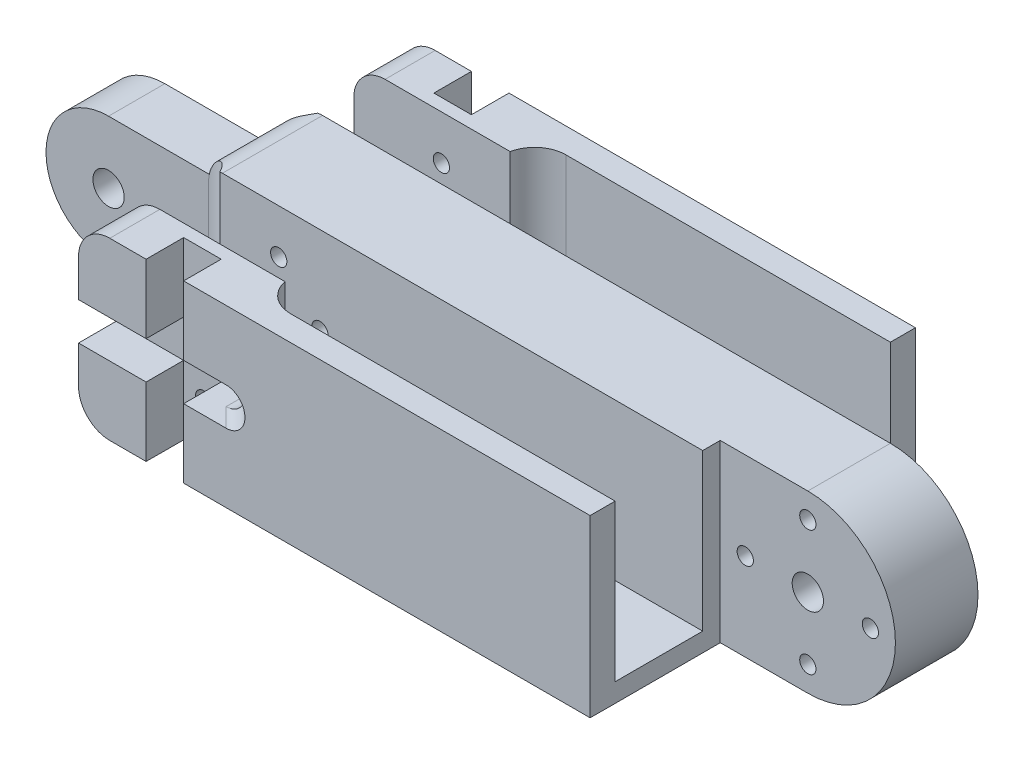
from build123d import *

# Parameters (mm, degrees)
SKETCH1_W                        = 81.77
SKETCH1_H                        = 28
BOSS_EXTRUDE1_DEPTH              = 4
BOSS_EXTRUDE2_DEPTH              = 4
SKETCH3_W                        = 81.77
SKETCH3_H                        = 3
BOSS_EXTRUDE3_DEPTH              = 10
BOSS_EXTRUDE4_DEPTH              = 4.2
BOSS_EXTRUDE5_DEPTH              = 9
SKETCH6_W                        = 81.77
SKETCH6_H                        = 28
BOSS_EXTRUDE6_DEPTH              = 2.8
SKETCH7_W                        = 81.77
SKETCH7_H                        = 3
BOSS_EXTRUDE7_DEPTH              = 10
BOSS_EXTRUDE8_DEPTH              = 4
SKETCH9_W                        = 81.77
SKETCH9_H                        = 28
BOSS_EXTRUDE9_DEPTH              = 4
FILLET1_R                        = 5
SKETCH10_R                       = 5
CUT_EXTRUDE2_DEPTH               = 25
CUT_EXTRUDE3_DEPTH               = 6
CUT_EXTRUDE4_START               = -6
CUT_EXTRUDE4_DEPTH               = 6
CUT_EXTRUDE5_REACH               = 119.503
SKETCH13_R                       = 2.5
CUT_EXTRUDE6_REACH               = 119.503
SKETCH14_R                       = 2.5
M3X0_5_TAPPED_HOLE1_D            = 2.6
M3X0_5_TAPPED_HOLE1_DEPTH        = 9
M3X0_5_TAPPED_HOLE1_TIP          = 0.781118805
TAP_DRILL_FOR_M3X0_5_TAP1_D      = 2.6
TAP_DRILL_FOR_M3X0_5_TAP2_REACH  = 141.209
TAP_DRILL_FOR_M3X0_5_TAP2_BORE_R = 1.3
CUT_EXTRUDE8_START               = 10.323759005
CUT_EXTRUDE8_DEPTH               = 9.676240995
BOSS_EXTRUDE10_DEPTH             = 0.01
BOSS_EXTRUDE10_DEPTH_BACK        = 0.01


with BuildPart() as part:
    # Sketch1 → Boss-Extrude1 (new body)
    with BuildSketch(Plane.XY):
        with Locations((40.885, 14)):
            Rectangle(SKETCH1_W, SKETCH1_H)
    extrude(amount=BOSS_EXTRUDE1_DEPTH)

    # Sketch2 → Boss-Extrude2 (add)
    with BuildSketch(Plane.XY.offset(4)):
        Polygon((0, 0), (25, 0), (81.77, 0), (81.77, 3), (25, 2.882144556), (25, 28), (0, 28), align=None)
    extrude(amount=BOSS_EXTRUDE2_DEPTH)

    # Sketch3 → Boss-Extrude3 (add)
    with BuildSketch(Plane.XY.offset(8)):
        with Locations((40.885, 1.5)):
            Rectangle(SKETCH3_W, SKETCH3_H)
    extrude(amount=BOSS_EXTRUDE3_DEPTH)

    # Sketch4 → Boss-Extrude4 (add)
    with BuildSketch(Plane.XY.offset(18)):
        with BuildLine():
            Line((0, 0), (95.77, 0))
            ThreePointArc((95.77, 0), (109.77, 14), (95.77, 28))
            Line((95.77, 28), (0, 28))
            Line((0, 28), (0, 0))
        make_face()
    extrude(amount=BOSS_EXTRUDE4_DEPTH)

    # Sketch5 → Boss-Extrude5 (add)
    with BuildSketch(Plane.XY.offset(22.2)):
        with BuildLine():
            Line((0, 24), (0, 28))
            Line((0, 28), (95.77, 28))
            ThreePointArc((95.77, 28), (109.77, 14), (95.77, 0))
            Line((95.77, 0), (0, 0))
            Line((0, 0), (0, 4))
            Line((0, 4), (-16, 4))
            ThreePointArc((-16, 4), (-26, 14), (-16, 24))
            Line((-16, 24), (0, 24))
        make_face()
    extrude(amount=BOSS_EXTRUDE5_DEPTH)

    # Sketch6 → Boss-Extrude6 (add)
    with BuildSketch(Plane.XY.offset(31.2)):
        with Locations((40.885, 14)):
            Rectangle(SKETCH6_W, SKETCH6_H)
    extrude(amount=BOSS_EXTRUDE6_DEPTH)

    # Sketch7 → Boss-Extrude7 (add)
    with BuildSketch(Plane.XY.offset(34)):
        with Locations((40.885, 1.5)):
            Rectangle(SKETCH7_W, SKETCH7_H)
    extrude(amount=BOSS_EXTRUDE7_DEPTH)

    # Sketch8 → Boss-Extrude8 (add)
    with BuildSketch(Plane.XY.offset(44)):
        Polygon((0, 0), (25, 0), (81.77, 0), (81.77, 3), (25, 3), (25, 28), (0, 28), align=None)
    extrude(amount=BOSS_EXTRUDE8_DEPTH)

    # Sketch9 → Boss-Extrude9 (add)
    with BuildSketch(Plane.XY.offset(48)):
        with Locations((40.885, 14)):
            Rectangle(SKETCH9_W, SKETCH9_H)
    extrude(amount=BOSS_EXTRUDE9_DEPTH)

    # Fillet1
    # the kernel refuses this fillet: 5 mm, written as the material it adds along each edge
    with BuildSketch(Plane(origin=(25, 3, 48), x_dir=(1.5729639812884161e-12, 0, -1.0), z_dir=(0, 1, 0))) as fillet1_piece_1:
        with BuildLine():
            CenterArc((5, -4.898979486), FILLET1_R, 101.536959033, 78.463040967)
            Line((0, -4.898979486), (0, 0))
            Line((0, 0), (4, 0))
        make_face()
    extrude(amount=25)
    with BuildSketch(Plane(origin=(25, -9.365304158, 4), x_dir=(1.5756285165475155e-12, 0, 1.0), z_dir=(0, 1, 0))) as fillet1_piece_2_section:
        with BuildLine():
            CenterArc((5, 4.898979486), FILLET1_R, 180, 78.463040967)
            Line((0, 4.898979486), (0, 0))
            Line((0, 0), (4, 0))
        make_face()
    fillet1_piece_2 = extrude(amount=37.365304158, mode=Mode.PRIVATE)
    fillet1_piece_2 = split(fillet1_piece_2, bisect_by=Plane(origin=(24.974574207, 2.882091771, 4), z_dir=(-0.0020760118056059734, 0.9999978450851698, 0)), keep=Keep.TOP, mode=Mode.PRIVATE)
    add(fillet1_piece_2)
    # the kernel refuses this fillet: 5 mm, written as the material it takes off along each edge
    with BuildSketch(Plane(origin=(0, 28, 46.5), x_dir=(0, -1, 0), z_dir=(0, 0, -1))) as fillet1_2_piece_1_section:
        with BuildLine():
            CenterArc((FILLET1_R, -FILLET1_R), FILLET1_R, 90, 90)
            Line((0, -FILLET1_R), (0, 0))
            Line((0, 0), (FILLET1_R, 0))
        make_face()
    fillet1_2_piece_1 = extrude(amount=41, mode=Mode.PRIVATE)
    fillet1_2_piece_1 = split(fillet1_2_piece_1, bisect_by=Plane(origin=(0, 28, 31.2), z_dir=(0, 0, 1)), keep=Keep.TOP, mode=Mode.PRIVATE)
    add(fillet1_2_piece_1, mode=Mode.SUBTRACT)
    with BuildSketch(Plane(origin=(0, 28, 46.5), x_dir=(0, -1, 0), z_dir=(0, 0, -1))) as fillet1_2_piece_2_section:
        with BuildLine():
            CenterArc((FILLET1_R, -FILLET1_R), FILLET1_R, 90, 90)
            Line((0, -FILLET1_R), (0, 0))
            Line((0, 0), (FILLET1_R, 0))
        make_face()
    fillet1_2_piece_2 = extrude(amount=41, mode=Mode.PRIVATE)
    fillet1_2_piece_2 = split(fillet1_2_piece_2, bisect_by=Plane(origin=(0, 24, 46.5), z_dir=(0, 1, 0)), keep=Keep.TOP, mode=Mode.PRIVATE)
    add(fillet1_2_piece_2, mode=Mode.SUBTRACT)
    with BuildSketch(Plane(origin=(0, 28, 46.5), x_dir=(0, -1, 0), z_dir=(0, 0, -1))) as fillet1_2_piece_3_section:
        with BuildLine():
            CenterArc((FILLET1_R, -FILLET1_R), FILLET1_R, 90, 90)
            Line((0, -FILLET1_R), (0, 0))
            Line((0, 0), (FILLET1_R, 0))
        make_face()
    fillet1_2_piece_3 = extrude(amount=41, mode=Mode.PRIVATE)
    fillet1_2_piece_3 = split(fillet1_2_piece_3, bisect_by=Plane(origin=(0, 28, 22.2), z_dir=(0, 0, -1)), keep=Keep.TOP, mode=Mode.PRIVATE)
    add(fillet1_2_piece_3, mode=Mode.SUBTRACT)
    with BuildSketch(Plane(origin=(0, 28, 64.5), x_dir=(0, -1, 0), z_dir=(0, 0, -1)), Plane(origin=(0, 28, 20.5), x_dir=(0, -1, 0), z_dir=(0, 0, -1))) as fillet1_2_piece_4:
        with BuildLine():
            CenterArc((FILLET1_R, -FILLET1_R), FILLET1_R, 90, 90)
            Line((0, -FILLET1_R), (0, 0))
            Line((0, 0), (FILLET1_R, 0))
        make_face()
    extrude(amount=33, mode=Mode.SUBTRACT)
    with BuildSketch(Plane(origin=(0, 0, 64.5), x_dir=(1, 0, 0), z_dir=(0, 0, -1))) as fillet1_2_piece_5_section:
        with BuildLine():
            CenterArc((FILLET1_R, -FILLET1_R), FILLET1_R, 90, 90)
            Line((0, -FILLET1_R), (0, 0))
            Line((0, 0), (FILLET1_R, 0))
        make_face()
    fillet1_2_piece_5 = extrude(amount=77, mode=Mode.PRIVATE)
    fillet1_2_piece_5 = split(fillet1_2_piece_5, bisect_by=Plane(origin=(0, 4, 64.5), z_dir=(0, -1, 0)), keep=Keep.TOP, mode=Mode.PRIVATE)
    add(fillet1_2_piece_5, mode=Mode.SUBTRACT)
    with BuildSketch(Plane(origin=(0, 0, 64.5), x_dir=(1, 0, 0), z_dir=(0, 0, -1))) as fillet1_2_piece_6_section:
        with BuildLine():
            CenterArc((FILLET1_R, -FILLET1_R), FILLET1_R, 90, 90)
            Line((0, -FILLET1_R), (0, 0))
            Line((0, 0), (FILLET1_R, 0))
        make_face()
    fillet1_2_piece_6 = extrude(amount=77, mode=Mode.PRIVATE)
    fillet1_2_piece_6 = split(fillet1_2_piece_6, bisect_by=Plane(origin=(0, 0, 31.2), z_dir=(0, 0, 1)), keep=Keep.TOP, mode=Mode.PRIVATE)
    add(fillet1_2_piece_6, mode=Mode.SUBTRACT)
    with BuildSketch(Plane(origin=(0, 0, 64.5), x_dir=(1, 0, 0), z_dir=(0, 0, -1))) as fillet1_2_piece_7_section:
        with BuildLine():
            CenterArc((FILLET1_R, -FILLET1_R), FILLET1_R, 90, 90)
            Line((0, -FILLET1_R), (0, 0))
            Line((0, 0), (FILLET1_R, 0))
        make_face()
    fillet1_2_piece_7 = extrude(amount=77, mode=Mode.PRIVATE)
    fillet1_2_piece_7 = split(fillet1_2_piece_7, bisect_by=Plane(origin=(0, 0, 22.2), z_dir=(0, 0, -1)), keep=Keep.TOP, mode=Mode.PRIVATE)
    add(fillet1_2_piece_7, mode=Mode.SUBTRACT)

    # Sketch10 → Cut-Extrude2 (cut)
    with BuildSketch(Plane(origin=(0, 28, 0), x_dir=(1, 0, 0), z_dir=(0, 1, 0))):
        with Locations((0.101020514, -36.2)):
            Circle(SKETCH10_R)
        with Locations((0.101021, -15.2)):
            Circle(SKETCH10_R)
    extrude(amount=-CUT_EXTRUDE2_DEPTH, mode=Mode.SUBTRACT)

    # Sketch11 → Cut-Extrude3 (cut)
    with BuildSketch(Plane.XY.offset(52)):
        with BuildLine():
            Line((16.8, 17), (20.6, 17))
            ThreePointArc((20.6, 17), (23.6, 14), (20.6, 11))
            Line((20.6, 11), (16.8, 11))
            Line((16.8, 11), (16.8, 0))
            Line((16.8, 0), (10.8, 0))
            Line((10.8, 0), (10.8, 11))
            Line((10.8, 11), (0, 11))
            Line((0, 11), (0, 17))
            Line((0, 17), (10.8, 17))
            Line((10.8, 17), (10.8, 28))
            Line((10.8, 28), (16.8, 28))
            Line((16.8, 28), (16.8, 17))
        make_face()
    extrude(amount=-CUT_EXTRUDE3_DEPTH, mode=Mode.SUBTRACT)

    # Sketch12 → Cut-Extrude4 (cut)
    with BuildSketch(Plane(origin=(0, 0, 0), x_dir=(-1, 0, 0), z_dir=(0, 0, -1)).offset(CUT_EXTRUDE4_START)):
        with BuildLine():
            Line((-16.8, 17), (-20.6, 17))
            ThreePointArc((-20.6, 17), (-23.6, 14), (-20.6, 11))
            Line((-20.6, 11), (-16.8, 11))
            Line((-16.8, 11), (-16.8, 0))
            Line((-16.8, 0), (-10.8, 0))
            Line((-10.8, 0), (-10.8, 11))
            Line((-10.8, 11), (0, 11))
            Line((0, 11), (0, 17))
            Line((0, 17), (-10.8, 17))
            Line((-10.8, 17), (-10.8, 28))
            Line((-10.8, 28), (-16.8, 28))
            Line((-16.8, 28), (-16.8, 17))
        make_face()
    extrude(amount=CUT_EXTRUDE4_DEPTH, mode=Mode.SUBTRACT)

    # Sketch13 → Cut-Extrude5 (cut, up to next)
    with BuildSketch(Plane.XY.offset(31.2), mode=Mode.PRIVATE) as cut_extrude5_sk1:
        with Locations((-16, 14)):
            Circle(SKETCH13_R)
    cut_extrude5_tool1 = extrude(cut_extrude5_sk1.sketch, amount=-CUT_EXTRUDE5_REACH, mode=Mode.PRIVATE) & part.part
    add(cut_extrude5_tool1.solids().sort_by_distance((-16, 14, 31.2))[0], mode=Mode.SUBTRACT)

    # Sketch14 → Cut-Extrude6 (cut, up to next)
    with BuildSketch(Plane.XY.offset(31.2), mode=Mode.PRIVATE) as cut_extrude6_sk1:
        with Locations((95.77, 14)):
            Circle(SKETCH14_R)
    cut_extrude6_tool1 = extrude(cut_extrude6_sk1.sketch, amount=-CUT_EXTRUDE6_REACH, mode=Mode.PRIVATE) & part.part
    add(cut_extrude6_tool1.solids().sort_by_distance((95.77, 14, 31.2))[0], mode=Mode.SUBTRACT)

    # M3x0.5 Tapped Hole1
    with Locations(Plane.XY.offset(31.2)):
        with Locations((95.77, 4), (85.77, 14), (95.77, 24), (105.77, 14)):
            Hole(M3X0_5_TAPPED_HOLE1_D / 2, depth=M3X0_5_TAPPED_HOLE1_DEPTH)
            with Locations((0, 0, -(M3X0_5_TAPPED_HOLE1_DEPTH + M3X0_5_TAPPED_HOLE1_TIP / 2))):  # 118° drill point
                Cone(0, M3X0_5_TAPPED_HOLE1_D / 2, M3X0_5_TAPPED_HOLE1_TIP, mode=Mode.SUBTRACT)

    # Tap Drill for M3x0.5 Tap1 (through all)
    with Locations(Plane.XY.offset(46)):
        with Locations((14, 20.9), (20.6, 14), (14, 7.1)):
            Hole(TAP_DRILL_FOR_M3X0_5_TAP1_D / 2)

    # Tap Drill for M3x0.5 Tap2 bore (on position points) → Tap Drill for M3x0.5 Tap2 (cut, up to next)
    with BuildSketch(Plane(origin=(-26, 14, 24.621750358), x_dir=(0, 0, -1), z_dir=(-1, 0, 0)), mode=Mode.PRIVATE) as tap_drill_for_m3x0_5_tap2_sk1:
        Circle(TAP_DRILL_FOR_M3X0_5_TAP2_BORE_R)
    tap_drill_for_m3x0_5_tap2_tool1 = extrude(tap_drill_for_m3x0_5_tap2_sk1.sketch, amount=-TAP_DRILL_FOR_M3X0_5_TAP2_REACH, mode=Mode.PRIVATE) & part.part
    add(tap_drill_for_m3x0_5_tap2_tool1.solids().sort_by_distance((-26, 14, 24.62175))[0], mode=Mode.SUBTRACT)

    # Cut-Extrude8: read off the stored shape, not the designer's step
    # Cut-Extrude8 outline → Cut-Extrude8 (cut)
    with BuildSketch(Plane(origin=(0, 0, 0), x_dir=(0.707106781186547, 0, 0.7071067811865481), z_dir=(0.707106781186548, 0, -0.7071067811865471)).offset(CUT_EXTRUDE8_START)):
        with BuildLine():
            Line((14, -17), (16.687720036, -17))
            add(Edge.make_bspline(
                [(16.687720036, -17), (18.80904038, -17), (18.80904038, -14), (18.80904038, -11), (16.687720036, -11)],
                knots=[1.570796327, 1.570796327, 1.570796327, 3.141592654, 3.141592654, 4.71238898, 4.71238898, 4.71238898], degree=2, weights=[1, 0.707106781, 1, 0.707106781, 1]))
            Line((16.687720036, -11), (14, -11))
            Line((14, -11), (14, -17))
        make_face()
    cut_extrude8 = extrude(amount=CUT_EXTRUDE8_DEPTH, mode=Mode.SUBTRACT)

    # Mirror1: Cut-Extrude8 across plane
    add(cut_extrude8.mirror(Plane(origin=(0, 0, 26), x_dir=(1, 0, 0), z_dir=(0, 0, -1))), mode=Mode.SUBTRACT)

    # Sketch22 → Boss-Extrude10 (add, two sides: drawn at the far end of the back side and taken through both)
    with BuildSketch(Plane.XZ.offset(-BOSS_EXTRUDE10_DEPTH_BACK)):
        Polygon((10.8, 6), (10.8, 0), (5.4, 0), (5.4, 50), (10.8, 50), (10.8, 44), (16.8, 44), (16.8, 50), (81.77, 50), (81.77, 0), (16.8, 0), (16.8, 6), align=None)
    extrude(amount=BOSS_EXTRUDE10_DEPTH + BOSS_EXTRUDE10_DEPTH_BACK)


solid = part.part
